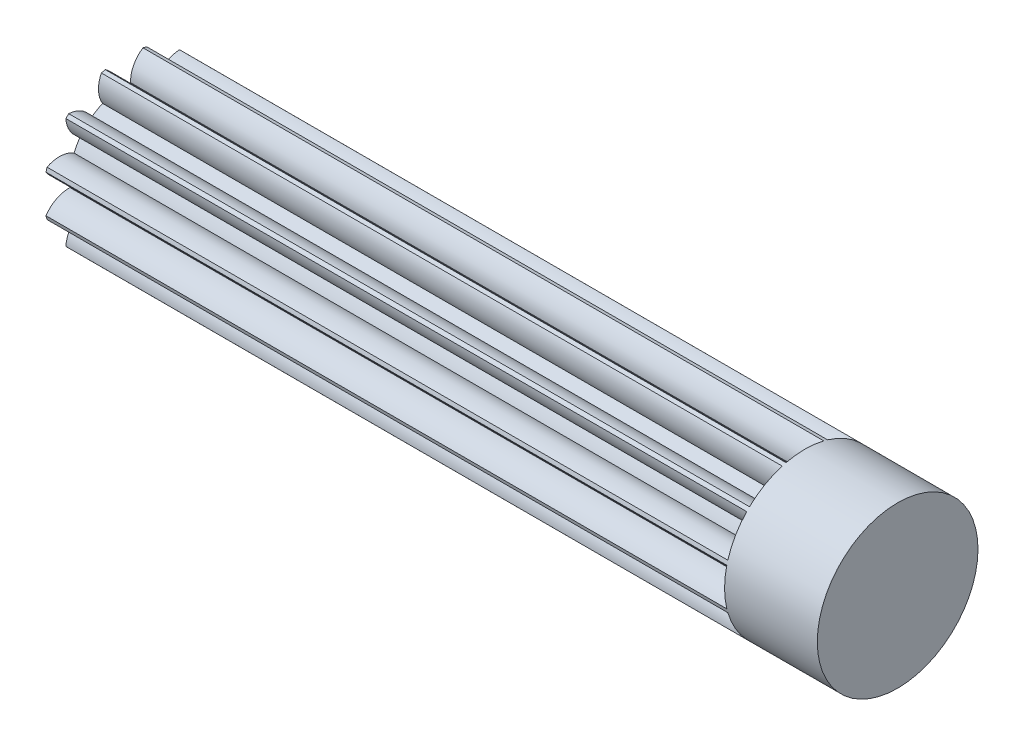
from build123d import *

# Parameters (mm, degrees)
BASPROSKE_W         = 59.315
BASPROSKE_H         = 7
TOOTHCUT_DEPTH      = 61.135424044
TEETHCUTS_COUNT     = 12
TEETHCUTS_ANGLE     = 330
BORSKE_R            = 0.4
BORE_DEPTH          = 50.0000508
SCALE1_SCALE        = 2
BOSS_EXTRUDE1_START = 16.163
SKETCH9_R           = 14
BOSS_EXTRUDE1_DEPTH = 16.163
SCALE2_SCALE        = 0.666666667
SKETCH10_R          = 4
CUT_EXTRUDE1_DEPTH  = 4.5
CUT_EXTRUDE3_DEPTH  = 15


with BuildPart() as part:
    # BasProSke → Base-Revolve (revolve)
    with BuildSketch(Plane(origin=(0, 0, 0), x_dir=(1, 0, 0), z_dir=(0, 1, 0))):
        with Locations((29.6575, 3.5)):
            Rectangle(BASPROSKE_W, BASPROSKE_H)
    revolve(axis=Axis((-10, 0, 0), (1, 0, 0)))

    # TooCutSke → ToothCut (cut, through all)
    with BuildSketch(Plane(origin=(0, 0, 0), x_dir=(0, 0, -1), z_dir=(1, 0, 0))):
        with BuildLine():
            ThreePointArc((0.562207301, 4.715604304), (0, 4.749), (-0.562207301, 4.715604304))
            ThreePointArc((-0.562207301, 4.715604304), (-0.837528627, 5.917009812), (-1.672850686, 6.823328788))
            ThreePointArc((-1.672850686, 6.823328788), (0, 7.0254), (1.672850686, 6.823328788))
            ThreePointArc((1.672850686, 6.823328788), (0.837528627, 5.917009812), (0.562207301, 4.715604304))
        make_face()
    toothcut = extrude(amount=TOOTHCUT_DEPTH, mode=Mode.SUBTRACT)

    # TeethCuts: ToothCut ×12 about axis
    teethcuts_axis = Axis((-10, 0, 0), (1, 0, 0))
    for i in range(1, TEETHCUTS_COUNT):
        add(toothcut.rotate(teethcuts_axis, i * TEETHCUTS_ANGLE / (TEETHCUTS_COUNT - 1)), mode=Mode.SUBTRACT)

    # BorSke → Bore (cut, symmetric)
    with BuildSketch(Plane(origin=(0, 0, 0), x_dir=(0, 0, -1), z_dir=(1, 0, 0))):
        Circle(BORSKE_R)
    extrude(amount=BORE_DEPTH, both=True, mode=Mode.SUBTRACT)


with BuildPart() as part_1:
    # Scale1: scaled about (29.676274456, 0, 0)
    add(part.part.scale(SCALE1_SCALE).moved(Location((-29.676274456, 0, 0))))

    # Sketch9 → Boss-Extrude1 (add)
    with BuildSketch(Plane(origin=(88.953725544, 0, 0), x_dir=(0, 0, -1), z_dir=(1, 0, 0)).offset(BOSS_EXTRUDE1_START)):
        Circle(SKETCH9_R)
    extrude(amount=-BOSS_EXTRUDE1_DEPTH)


with BuildPart() as part_2:
    # Scale2: scaled about (40.880908015, 0, 0)
    add(part_1.part.scale(SCALE2_SCALE).moved(Location((13.626969338, 0, 0))))

    # Sketch10 → Cut-Extrude1 (cut)
    with BuildSketch(Plane.ZY.offset(6.157213633)):
        Circle(SKETCH10_R)
    extrude(amount=-CUT_EXTRUDE1_DEPTH, mode=Mode.SUBTRACT)

    # Sketch11 → Cut-Extrude3 (cut)
    with BuildSketch(Plane.ZY.offset(1.657213633)):
        with BuildLine():
            Line((1.85, 3.546477125), (1.85, -3.546477125))
            ThreePointArc((1.85, -3.546477125), (-4, 0), (1.85, 3.546477125))
        make_face()
    extrude(amount=-CUT_EXTRUDE3_DEPTH, mode=Mode.SUBTRACT)


solid = part_2.part
